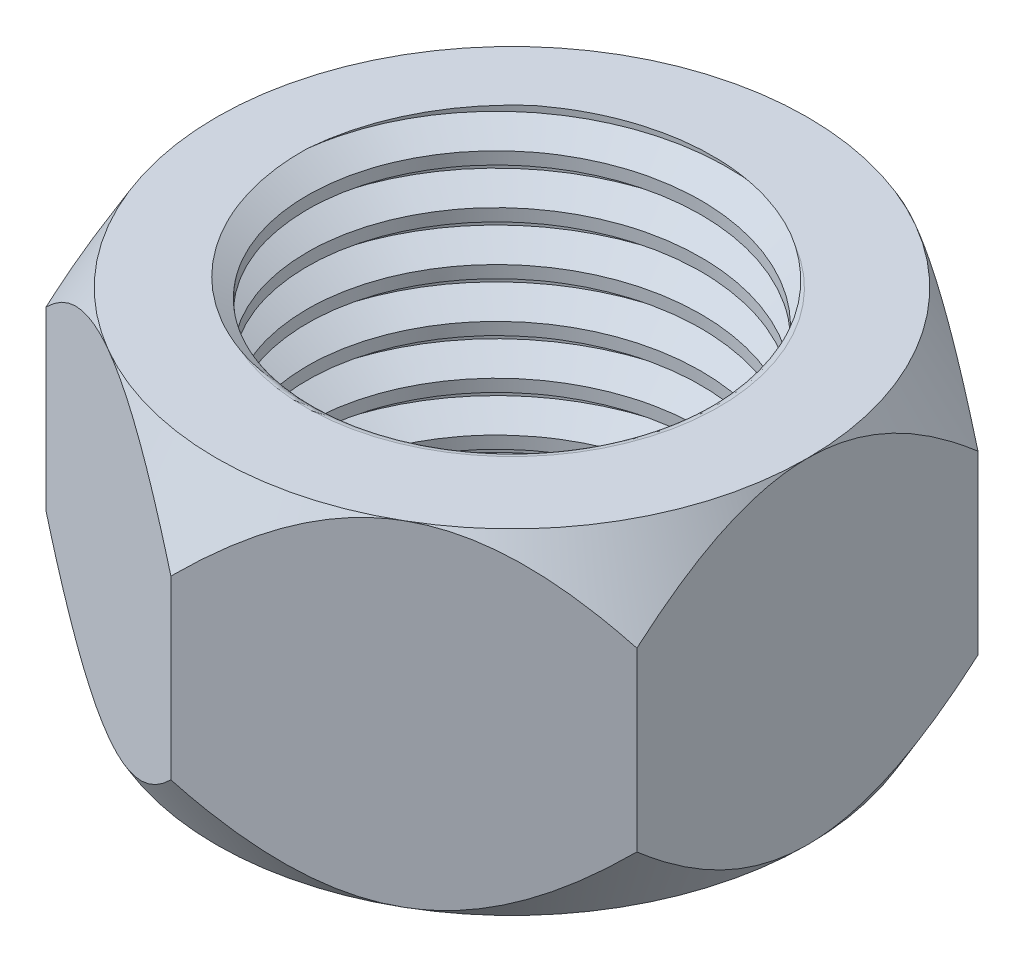
from build123d import *

# Parameters (mm, degrees)
BOSS_EXTRUDE1_DEPTH = 17
SKETCH2_OUTSIDE_W   = 53.322
SKETCH2_OUTSIDE_H   = 57.964
SKETCH2_OUTSIDE_R   = 15
CUT_EXTRUDE1_DEPTH  = 10
CUT_EXTRUDE1_DRAFT  = -30
SKETCH3_OUTSIDE_W   = 53.322
SKETCH3_OUTSIDE_H   = 57.964
SKETCH3_OUTSIDE_R   = 15
CUT_EXTRUDE2_DEPTH  = 10
CUT_EXTRUDE2_DRAFT  = -30
SKETCH4_R           = 10
CUT_EXTRUDE3_DEPTH  = 29.530685235
FILLET1_R           = 0.5
THREAD1_PITCH       = 2.5


with BuildPart() as part:
    # Sketch1 → Boss-Extrude1 (new body)
    with BuildSketch(Plane(origin=(0, 0, 0), x_dir=(1, 0, 0), z_dir=(0, 1, 0))):
        Polygon((0, 17.320508076), (-15, 8.660254038), (-15, -8.660254038), (0, -17.320508076), (15, -8.660254038), (15, 8.660254038), align=None)
    extrude(amount=BOSS_EXTRUDE1_DEPTH)


with BuildPart() as cut_extrude1_tool:
    # Sketch2 outside → Cut-Extrude1 (with draft: the straight prism first)
    with BuildSketch(Plane(origin=(0, 17, 0), x_dir=(1, 0, 0), z_dir=(0, 1, 0))):
        Rectangle(SKETCH2_OUTSIDE_W, SKETCH2_OUTSIDE_H)
        Circle(SKETCH2_OUTSIDE_R, mode=Mode.SUBTRACT)
    extrude(amount=-CUT_EXTRUDE1_DEPTH)
    # Cut-Extrude1: the draft: its side faces are tilted about the plane it starts from
    cut_extrude1_sides = [cut_extrude1_tool.faces().sort_by_distance(p)[0] for p in [
        (0, 12, 28.982),
        (26.661, 12, 0),
        (0, 12, -28.982),
        (-26.661, 12, 0),
        (-15, 12, 0),
    ]]
    draft(cut_extrude1_sides, Plane(origin=(0, 17, 0), x_dir=(1, 0, 0), z_dir=(0, 1, 0)), CUT_EXTRUDE1_DRAFT)


with BuildPart() as part_1:
    add(part.part)

    # Cut-Extrude1: cut by cut_extrude1_tool
    add(cut_extrude1_tool.part, mode=Mode.SUBTRACT)


with BuildPart() as cut_extrude2_tool:
    # Sketch3 outside → Cut-Extrude2 (with draft: the straight prism first)
    with BuildSketch(Plane.XZ):
        Rectangle(SKETCH3_OUTSIDE_W, SKETCH3_OUTSIDE_H)
        Circle(SKETCH3_OUTSIDE_R, mode=Mode.SUBTRACT)
    extrude(amount=-CUT_EXTRUDE2_DEPTH)
    # Cut-Extrude2: the draft: its side faces are tilted about the plane it starts from
    cut_extrude2_sides = [cut_extrude2_tool.faces().sort_by_distance(p)[0] for p in [
        (0, 5, -28.982),
        (26.661, 5, 0),
        (0, 5, 28.982),
        (-26.661, 5, 0),
        (-15, 5, 0),
    ]]
    draft(cut_extrude2_sides, Plane.XZ, CUT_EXTRUDE2_DRAFT)


with BuildPart() as part_2:
    add(part_1.part)

    # Cut-Extrude2: cut by cut_extrude2_tool
    add(cut_extrude2_tool.part, mode=Mode.SUBTRACT)

    # Sketch4 → Cut-Extrude3 (cut, through all)
    with BuildSketch(Plane.XZ):
        with Locations(Location((0, 0, 0), (0, 0, 270))):
            Circle(SKETCH4_R)
    extrude(amount=-CUT_EXTRUDE3_DEPTH, mode=Mode.SUBTRACT)

    # Fillet1
    fillet1_edges = [part_2.edges().sort_by_distance(p)[0] for p in [
        (0, 17, 10),
        (0, 0, 10),
    ]]
    fillet(fillet1_edges, radius=FILLET1_R)

    # Thread1: the profile of Thread Profile1 profile screwed along a right-hand helix of 7.8 turns, 10 arcs to a turn; built about Z, then put on its axis
    thread1_z = Axis((0, 0, 0), (0, 0, 1))
    thread1_corners = [(9.9997, 0, -0.000173205), (11.353164687, 0, 0.781249997), (11.353164687, 0, 1.093749997), (9.9997, 0, 1.875173198)]
    with BuildLine(mode=Mode.PRIVATE) as thread1_profile:
        Line(thread1_corners[0], thread1_corners[1])
        Line(thread1_corners[1], thread1_corners[2])
        Line(thread1_corners[2], thread1_corners[3])
        Line(thread1_corners[3], thread1_corners[0])
    thread1_cap = Face(thread1_profile.wire())
    thread1_turn_angles = [0, 18, 36, 54, 72, 90, 108, 126, 144, 162, 180, 198, 216, 234, 252, 270, 288, 306, 324, 342, 360]
    thread1_turn_weights = [1, 0.9510565162951535, 1, 0.9510565162951535, 1, 0.9510565162951535, 1, 0.9510565162951535, 1, 0.9510565162951535, 1, 0.9510565162951535, 1, 0.9510565162951535, 1, 0.9510565162951535, 1, 0.9510565162951535, 1, 0.9510565162951535, 1]
    thread1_turn_rails = [Edge.make_bspline([Vector(p[0], p[1], 0).rotate(thread1_z, thread1_turn_angles[k]) / thread1_turn_weights[k] + Vector(0, 0, p[2] + THREAD1_PITCH * thread1_turn_angles[k] / 360) for k in range(21)], [0, 0, 0, 1, 1, 2, 2, 3, 3, 4, 4, 5, 5, 6, 6, 7, 7, 8, 8, 9, 9, 10, 10, 10], 2, thread1_turn_weights) for p in thread1_corners]
    thread1_turn_sides = [Face.make_surface_from_curves(thread1_turn_rails[p[0]], thread1_turn_rails[p[1]]) for p in [(0, 1), (1, 2), (2, 3), (3, 0)]]
    thread1_last_angles = [2520, 2538, 2556, 2574, 2592, 2610, 2628, 2646, 2664, 2682, 2700, 2718, 2736, 2754, 2772, 2790, 2808]
    thread1_last_weights = [1, 0.9510565162951535, 1, 0.9510565162951535, 1, 0.9510565162951535, 1, 0.9510565162951535, 1, 0.9510565162951535, 1, 0.9510565162951535, 1, 0.9510565162951535, 1, 0.9510565162951548, 1]
    thread1_last_rails = [Edge.make_bspline([Vector(p[0], p[1], 0).rotate(thread1_z, thread1_last_angles[k]) / thread1_last_weights[k] + Vector(0, 0, p[2] + THREAD1_PITCH * thread1_last_angles[k] / 360) for k in range(17)], [0, 0, 0, 1, 1, 2, 2, 3, 3, 4, 4, 5, 5, 6, 6, 7, 7, 8, 8, 8], 2, thread1_last_weights) for p in thread1_corners]
    thread1_last_sides = [Face.make_surface_from_curves(thread1_last_rails[p[0]], thread1_last_rails[p[1]]) for p in [(0, 1), (1, 2), (2, 3), (3, 0)]]
    thread1 = Plane(origin=(0, -2.5, 0), x_dir=(1, 0, 0), z_dir=(0, 1, 0)) * Solid(Shell([*[p.moved(Location((0, 0, THREAD1_PITCH * i))) for i in range(7) for p in thread1_turn_sides], *thread1_last_sides, thread1_cap, thread1_cap.rotate(thread1_z, 2808).moved(Location((0, 0, THREAD1_PITCH * 2808 / 360)))]))
    add(thread1, mode=Mode.SUBTRACT)


solid = part_2.part
